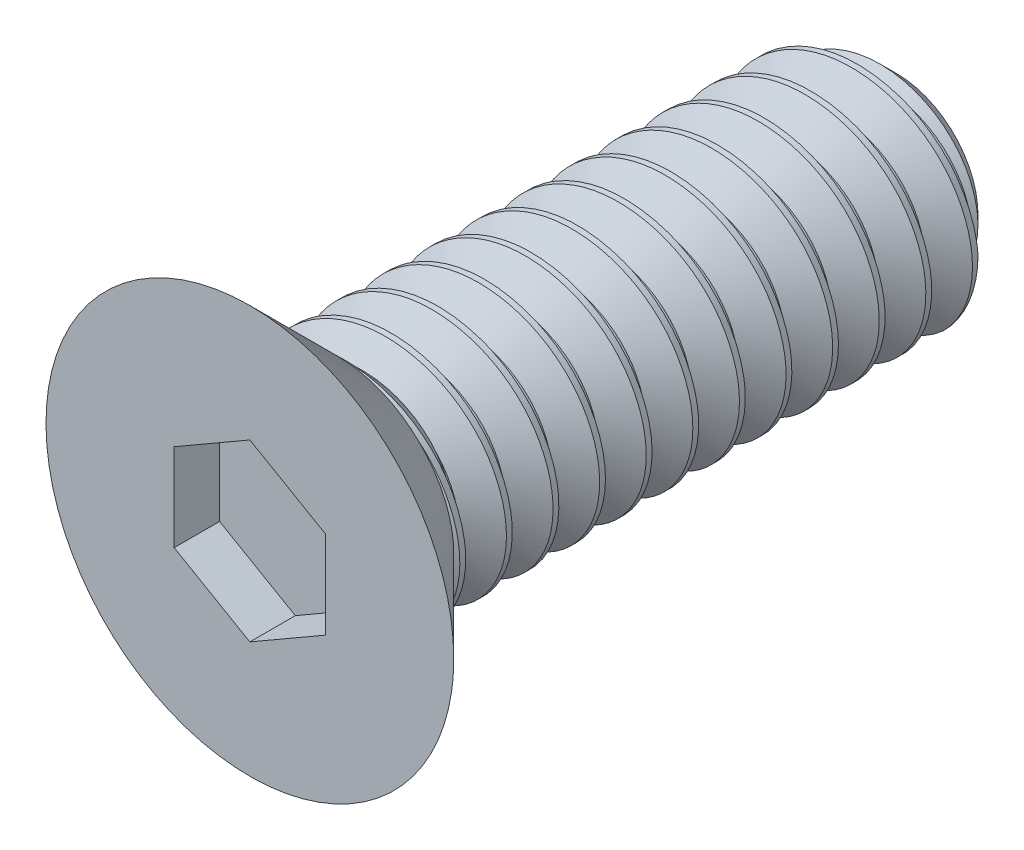
from build123d import *
from build123d.topology import SkipClean

# Parameters (mm, degrees)
SKETCH1_W          = 6
SKETCH1_H          = 1
CHAMFER1_SIZE      = 0.3
CUT_SWEEP1_PITCH   = 0.4
CUT_EXTRUDE2_DEPTH = 0.84
SKETCH11_W         = 0.45
SKETCH11_H         = 2


with BuildPart() as part:
    # Sketch1 → Revolve1 (revolve)
    with BuildSketch(Plane(origin=(0, 0, 0), x_dir=(0, 0, -1), z_dir=(1, 0, 0))):
        with Locations((3, 0.5)):
            Rectangle(SKETCH1_W, SKETCH1_H)
    revolve(axis=Axis((0, 0, -6), (0, 0, 1)))

    # Chamfer1
    chamfer1_edges = [part.edges().sort_by_distance(p)[0] for p in [
        (0, -1, -6),
    ]]
    chamfer(chamfer1_edges, length=CHAMFER1_SIZE)

    # Cut-Sweep1: the profile of Sketch2 profile screwed along a right-hand helix of 15 turns, 6 arcs to a turn; built about Z, then put on its axis
    cut_sweep1_z = Axis((0, 0, 0), (0, 0, 1))
    cut_sweep1_corners = [(1.0006, 0, 0.00034641), (1.0006, 0, -0.35034641), (0.740192379, 0, -0.2), (0.740192379, 0, -0.15)]
    with BuildLine(mode=Mode.PRIVATE) as cut_sweep1_profile:
        Line(cut_sweep1_corners[0], cut_sweep1_corners[1])
        Line(cut_sweep1_corners[1], cut_sweep1_corners[2])
        Line(cut_sweep1_corners[2], cut_sweep1_corners[3])
        Line(cut_sweep1_corners[3], cut_sweep1_corners[0])
    cut_sweep1_cap = Face(cut_sweep1_profile.wire())
    cut_sweep1_turn_angles = [0, 30, 60, 90, 120, 150, 180, 210, 240, 270, 300, 330, 360]
    cut_sweep1_turn_weights = [1, 0.8660254037844387, 1, 0.8660254037844387, 1, 0.8660254037844387, 1, 0.8660254037844387, 1, 0.8660254037844387, 1, 0.8660254037844387, 1]
    cut_sweep1_turn_rails = [Edge.make_bspline([Vector(p[0], p[1], 0).rotate(cut_sweep1_z, cut_sweep1_turn_angles[k]) / cut_sweep1_turn_weights[k] + Vector(0, 0, p[2] + CUT_SWEEP1_PITCH * cut_sweep1_turn_angles[k] / 360) for k in range(13)], [0, 0, 0, 1, 1, 2, 2, 3, 3, 4, 4, 5, 5, 6, 6, 6], 2, cut_sweep1_turn_weights) for p in cut_sweep1_corners]
    cut_sweep1_turn_sides = [Face.make_surface_from_curves(cut_sweep1_turn_rails[p[0]], cut_sweep1_turn_rails[p[1]]) for p in [(0, 1), (1, 2), (2, 3), (3, 0)]]
    cut_sweep1 = Plane(origin=(0, 0, -6), x_dir=(0, 1, 0), z_dir=(0, 0, 1)) * Solid(Shell([*[p.moved(Location((0, 0, CUT_SWEEP1_PITCH * i))) for i in range(15) for p in cut_sweep1_turn_sides], cut_sweep1_cap, cut_sweep1_cap.rotate(cut_sweep1_z, 5400).moved(Location((0, 0, CUT_SWEEP1_PITCH * 5400 / 360)))]))
    add(cut_sweep1, mode=Mode.SUBTRACT)

    # Sketch7 → Revolve2 (revolve)
    with BuildSketch(Plane(origin=(0, 0, 0), x_dir=(0, 0, -1), z_dir=(1, 0, 0)), mode=Mode.PRIVATE) as revolve2_sk:
        Polygon((0, 2), (0.2, 2), (1.2, 1), (1.2, 0), (0, 0), align=None)
    revolve(revolve2_sk.sketch.rotate(Axis((0, 0, 0), (0, 0, -1)), 189.336081704), axis=Axis((0, 0, 0), (0, 0, -1)))

    # Boss-Extrude1 cone 1 section (through the dimple's axis) → Boss-Extrude1 (revolve)
    with SkipClean():  # the faces are left unmerged after this step: merging them gives an invalid solid
        with BuildSketch(Plane(origin=(0, 0, -1.2), x_dir=(0, -1, 0), z_dir=(1, 0, 0))):
            Polygon((0, 0), (1, 0), (0, 1), align=None)
        revolve(axis=Axis((0, 0, -1.2), (0, 0, -1)))

    # Sketch5 → Cut-Extrude2 (cut)
    with SkipClean():  # the faces are left unmerged after this step: merging them gives an invalid solid
        with BuildSketch(Plane.XY):
            Polygon((0.65, -0.375277675), (0.65, 0.375277675), (0, 0.75055535), (-0.65, 0.375277675), (-0.65, -0.375277675), (0, -0.75055535), align=None)
        extrude(amount=-CUT_EXTRUDE2_DEPTH, mode=Mode.SUBTRACT)

    # Cut-Extrude3 cone 1 section (through the dimple's axis) → Cut-Extrude3 (revolve, cut)
    with SkipClean():  # the faces are left unmerged after this step: merging them gives an invalid solid
        with BuildSketch(Plane(origin=(0, 0, 0), x_dir=(0, -1, 0), z_dir=(1, 0, 0))):
            Polygon((0, 0), (0.75055535, 0), (0, 0.75055535), align=None)
        revolve(axis=Axis((0, 0, 0), (0, 0, -1)), mode=Mode.SUBTRACT)

    # Sketch11 → Cut-Revolve1 (revolve, cut)
    with SkipClean():  # the faces are left unmerged after this step: merging them gives an invalid solid
        with BuildSketch(Plane(origin=(0, 0, 0), x_dir=(0, 0, -1), z_dir=(1, 0, 0)), mode=Mode.PRIVATE) as cut_revolve1_sk:
            with Locations((0.225, 1)):
                Rectangle(SKETCH11_W, SKETCH11_H)
        revolve(cut_revolve1_sk.sketch.rotate(Axis((0, 0, 0), (0, 0, -1)), 189.336081704), axis=Axis((0, 0, 0), (0, 0, -1)), mode=Mode.SUBTRACT)


solid = part.part
